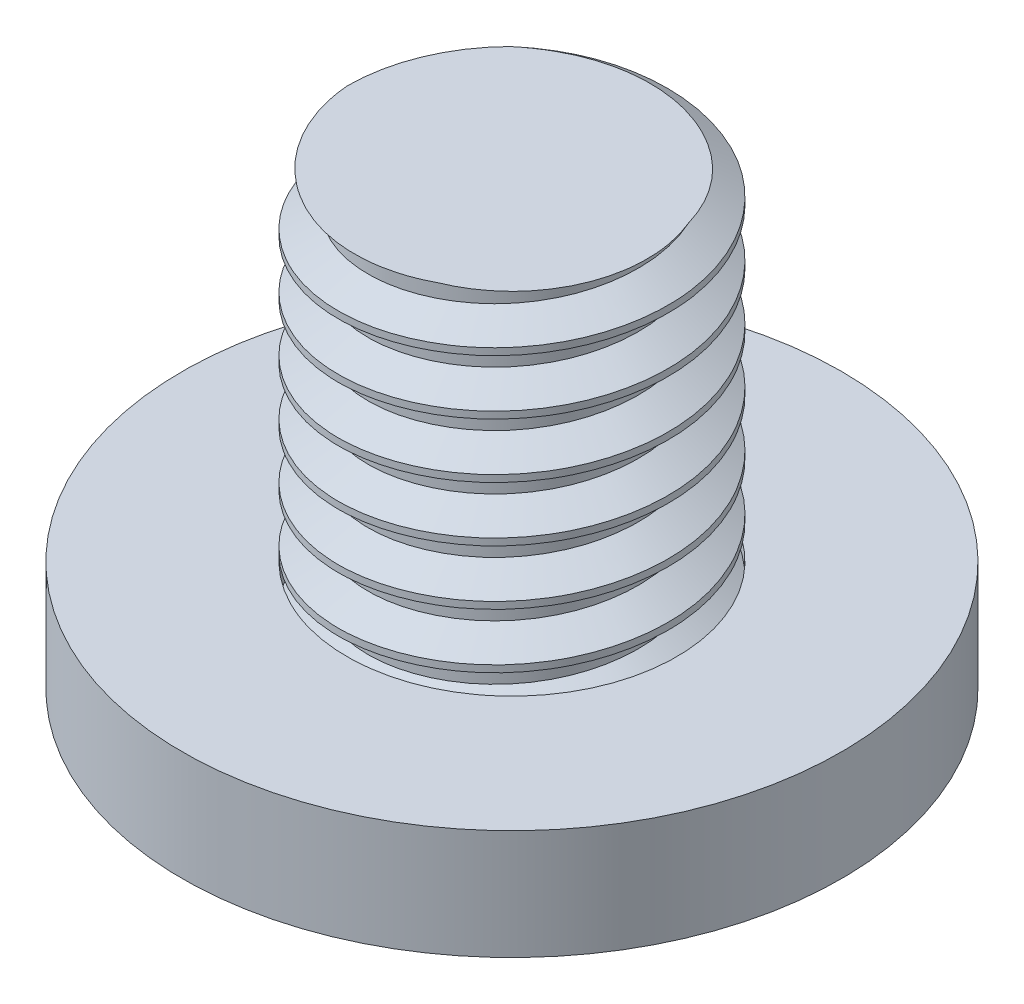
from build123d import *

# Parameters (mm, degrees)
THREAD_2_PITCH = 0.5


with BuildPart() as part:
    # 草图1 → 旋转2 (revolve)
    with BuildSketch(Plane.XY, mode=Mode.PRIVATE) as revolve_2_sk:
        Polygon((-3, -2), (0, -2), (0, 2), (-1.5, 2), (-1.5, -1), (-3, -1), align=None)
    revolve(revolve_2_sk.sketch.rotate(Axis((0, -5.149473427, 0), (0, 1, 0)), 270), axis=Axis((0, -5.149473427, 0), (0, 1, 0)))

    # 螺纹线2: the profile of 螺纹线轮廓2 profile screwed along a right-hand helix of 8 turns, 6 arcs to a turn; built about Z, then put on its axis
    thread_2_z = Axis((0, 0, 0), (0, 0, 1))
    thread_2_corners = [(1.5003, 0, -0.000173205), (1.5003, 0, 0.437673204), (1.229367062, 0, 0.281249999), (1.229367062, 0, 0.156249999)]
    with BuildLine(mode=Mode.PRIVATE) as thread_2_profile:
        Line(thread_2_corners[0], thread_2_corners[1])
        Line(thread_2_corners[1], thread_2_corners[2])
        Line(thread_2_corners[2], thread_2_corners[3])
        Line(thread_2_corners[3], thread_2_corners[0])
    thread_2_cap = Face(thread_2_profile.wire())
    thread_2_turn_angles = [0, 30, 60, 90, 120, 150, 180, 210, 240, 270, 300, 330, 360]
    thread_2_turn_weights = [1, 0.8660254037844387, 1, 0.8660254037844387, 1, 0.8660254037844387, 1, 0.8660254037844387, 1, 0.8660254037844387, 1, 0.8660254037844387, 1]
    thread_2_turn_rails = [Edge.make_bspline([Vector(p[0], p[1], 0).rotate(thread_2_z, thread_2_turn_angles[k]) / thread_2_turn_weights[k] + Vector(0, 0, p[2] + THREAD_2_PITCH * thread_2_turn_angles[k] / 360) for k in range(13)], [0, 0, 0, 1, 1, 2, 2, 3, 3, 4, 4, 5, 5, 6, 6, 6], 2, thread_2_turn_weights) for p in thread_2_corners]
    thread_2_turn_sides = [Face.make_surface_from_curves(thread_2_turn_rails[p[0]], thread_2_turn_rails[p[1]]) for p in [(0, 1), (1, 2), (2, 3), (3, 0)]]
    thread_2 = Plane(origin=(0, 3, 0), x_dir=(-1, 0, 0), z_dir=(0, -1, 0)) * Solid(Shell([*[p.moved(Location((0, 0, THREAD_2_PITCH * i))) for i in range(8) for p in thread_2_turn_sides], thread_2_cap, thread_2_cap.rotate(thread_2_z, 2880).moved(Location((0, 0, THREAD_2_PITCH * 2880 / 360)))]))
    add(thread_2, mode=Mode.SUBTRACT)


solid = part.part
